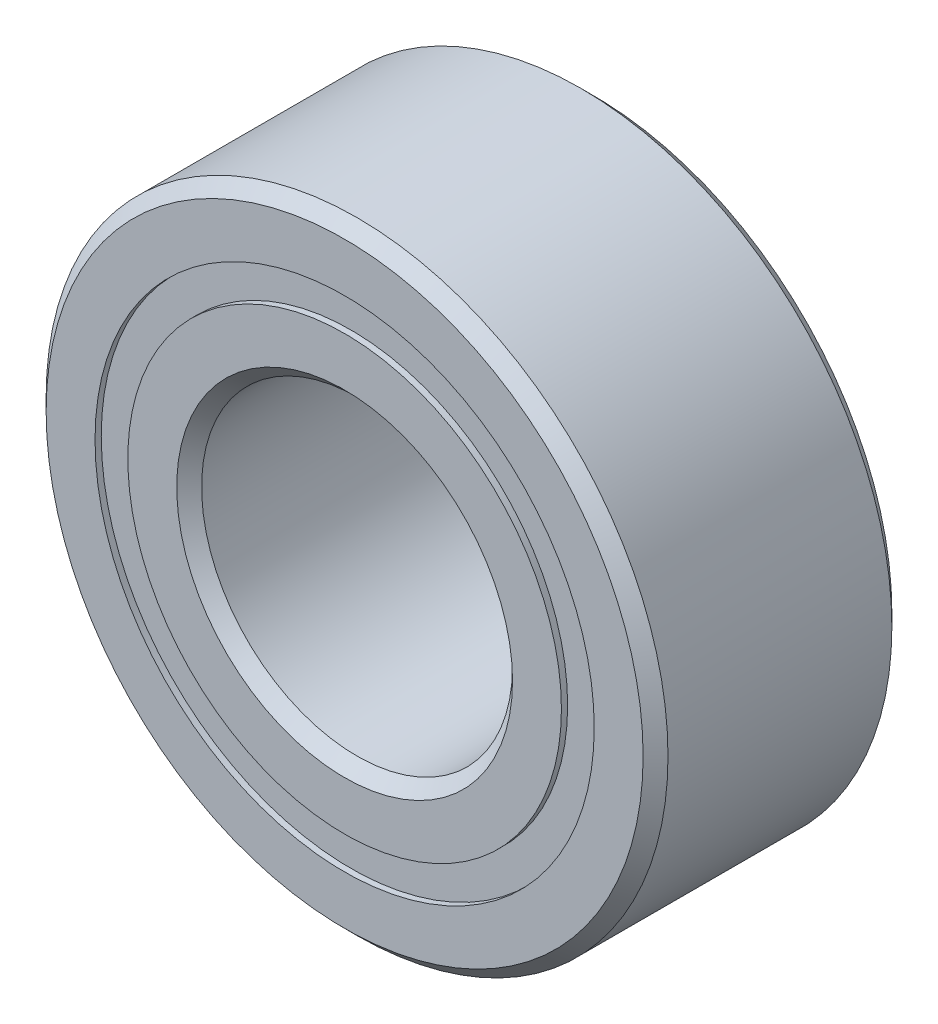
from build123d import *

# Parameters (mm, degrees)
CIRPATTERN1_COUNT = 12
SKETCH5_W         = 0.972810551
SKETCH5_H         = 0.527472528


with BuildPart() as part:
    # Sketch1 → Revolve1 (revolve)
    with BuildSketch(Plane(origin=(0, 0, 0), x_dir=(0, 0, -1), z_dir=(1, 0, 0))):
        with BuildLine():
            Line((1.8, 5), (-1.8, 5))
            Line((-1.8, 5), (-2, 4.8))
            Line((-2, 4.8), (-2, 4.013736264))
            Line((-2, 4.013736264), (-0.888888889, 4.013736264))
            ThreePointArc((-0.888888889, 4.013736264), (0, 4.677189449), (0.888888889, 4.013736264))
            Line((0.888888889, 4.013736264), (2, 4.013736264))
            Line((2, 4.013736264), (2, 4.8))
            Line((2, 4.8), (1.8, 5))
        make_face()
    revolve(axis=Axis((0, 0, 2), (0, 0, -1)))


with BuildPart() as body_2:
    # Sketch3 → Revolve3 (revolve)
    with BuildSketch(Plane(origin=(0, 0, 0), x_dir=(0, 0, -1), z_dir=(1, 0, 0))):
        with BuildLine():
            Line((-2, 3.486263736), (-0.888888889, 3.486263736))
            ThreePointArc((-0.888888889, 3.486263736), (0, 2.822810551), (0.888888889, 3.486263736))
            Line((0.888888889, 3.486263736), (2, 3.486263736))
            Line((2, 3.486263736), (2, 2.7))
            Line((2, 2.7), (1.8, 2.5))
            Line((1.8, 2.5), (-1.8, 2.5))
            Line((-1.8, 2.5), (-2, 2.7))
            Line((-2, 2.7), (-2, 3.486263736))
        make_face()
    revolve(axis=Axis((0, 0, 2), (0, 0, -1)))


with BuildPart() as body_3:
    # Sketch4 → Revolve4 (revolve)
    with BuildSketch(Plane(origin=(0, 0, 0), x_dir=(0, 0, -1), z_dir=(1, 0, 0))):
        with BuildLine():
            Line((-0.927189449, 3.75), (0.927189449, 3.75))
            ThreePointArc((0.927189449, 3.75), (0, 4.677189449), (-0.927189449, 3.75))
        make_face()
    revolve(axis=Axis((0, 3.75, 0.927189449), (0, 0, -1)))


with BuildPart() as cirpattern1_1:
    # CirPattern1: pattern copy
    add(body_3.part.rotate(Axis((0, 0, -2), (0, 0, 1)), 1 * 360 / CIRPATTERN1_COUNT))


with BuildPart() as cirpattern1_2:
    # CirPattern1: pattern copy
    add(body_3.part.rotate(Axis((0, 0, -2), (0, 0, 1)), 2 * 360 / CIRPATTERN1_COUNT))


with BuildPart() as cirpattern1_3:
    # CirPattern1: pattern copy
    add(body_3.part.rotate(Axis((0, 0, -2), (0, 0, 1)), 3 * 360 / CIRPATTERN1_COUNT))


with BuildPart() as cirpattern1_4:
    # CirPattern1: pattern copy
    add(body_3.part.rotate(Axis((0, 0, -2), (0, 0, 1)), 4 * 360 / CIRPATTERN1_COUNT))


with BuildPart() as cirpattern1_5:
    # CirPattern1: pattern copy
    add(body_3.part.rotate(Axis((0, 0, -2), (0, 0, 1)), 5 * 360 / CIRPATTERN1_COUNT))


with BuildPart() as cirpattern1_6:
    # CirPattern1: pattern copy
    add(body_3.part.rotate(Axis((0, 0, -2), (0, 0, 1)), 6 * 360 / CIRPATTERN1_COUNT))


with BuildPart() as cirpattern1_7:
    # CirPattern1: pattern copy
    add(body_3.part.rotate(Axis((0, 0, -2), (0, 0, 1)), 7 * 360 / CIRPATTERN1_COUNT))


with BuildPart() as cirpattern1_8:
    # CirPattern1: pattern copy
    add(body_3.part.rotate(Axis((0, 0, -2), (0, 0, 1)), 8 * 360 / CIRPATTERN1_COUNT))


with BuildPart() as cirpattern1_9:
    # CirPattern1: pattern copy
    add(body_3.part.rotate(Axis((0, 0, -2), (0, 0, 1)), 9 * 360 / CIRPATTERN1_COUNT))


with BuildPart() as cirpattern1_10:
    # CirPattern1: pattern copy
    add(body_3.part.rotate(Axis((0, 0, -2), (0, 0, 1)), 10 * 360 / CIRPATTERN1_COUNT))


with BuildPart() as cirpattern1_11:
    # CirPattern1: pattern copy
    add(body_3.part.rotate(Axis((0, 0, -2), (0, 0, 1)), 11 * 360 / CIRPATTERN1_COUNT))


with BuildPart() as body_15:
    # Sketch5 → Revolve5 (revolve)
    with BuildSketch(Plane(origin=(0, 0, 0), x_dir=(0, 0, -1), z_dir=(1, 0, 0))):
        with Locations((-1.413594725, 3.75)):
            Rectangle(SKETCH5_W, SKETCH5_H)
        with Locations((1.413594725, 3.75)):
            Rectangle(SKETCH5_W, SKETCH5_H)
    revolve(axis=Axis((0, 0, 2), (0, 0, -1)))


solid = Compound([part.part, body_2.part, body_3.part, cirpattern1_1.part, cirpattern1_2.part, cirpattern1_3.part, cirpattern1_4.part, cirpattern1_5.part, cirpattern1_6.part, cirpattern1_7.part, cirpattern1_8.part, cirpattern1_9.part, cirpattern1_10.part, cirpattern1_11.part, body_15.part])
